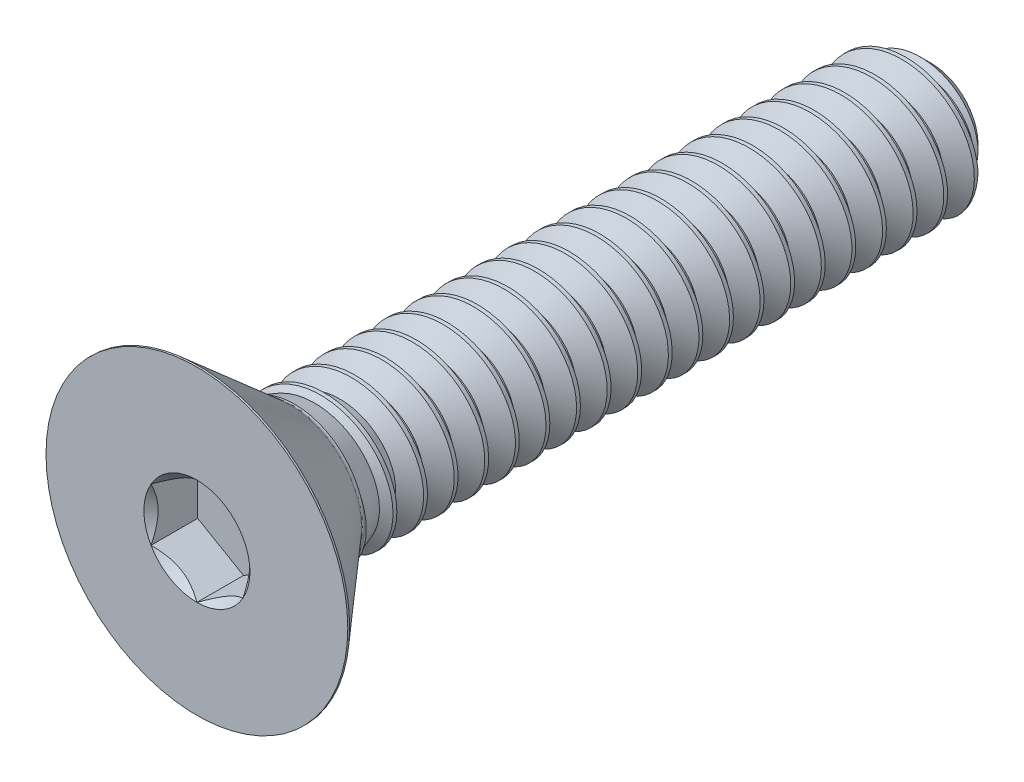
from build123d import *

# Parameters (mm, degrees)
SKETCH10_R         = 1.833087105
CUT_EXTRUDE2_DEPTH = 1.6129
CUT_EXTRUDE2_DRAFT = -45
CUT_EXTRUDE1_DEPTH = 1.6129
CUT_SWEEP1_PITCH   = 1.058333333
CUT_SWEEP1_TO      = 22.017366


with BuildPart() as part:
    # Sketch2 → Revolve1 (revolve)
    with BuildSketch(Plane(origin=(0, 0, 0), x_dir=(0, 0, -1), z_dir=(1, 0, 0)), mode=Mode.PRIVATE) as revolve1_sk:
        with BuildLine():
            Line((-12.635484, 5.2197), (-9.4742, 2.471637744))
            ThreePointArc((-9.4742, 2.471637744), (-9.40108483, 2.428138789), (-9.317366229, 2.413))
            Line((-9.317366229, 2.413), (11.90625, 2.413))
            Line((11.90625, 2.413), (12.7, 1.61925))
            Line((12.7, 1.61925), (12.7, 0))
            Line((12.7, 0), (-12.7, 0))
            Line((-12.7, 0), (-12.7, 5.2197))
            Line((-12.7, 5.2197), (-12.635484, 5.2197))
        make_face()
    revolve(revolve1_sk.sketch.rotate(Axis((0, 0, -12.7), (0, 0, 1)), 90), axis=Axis((0, 0, -12.7), (0, 0, 1)))


with BuildPart() as cut_extrude2_tool:
    # Sketch10 → Cut-Extrude2 (with draft: the straight prism first)
    with BuildSketch(Plane.XY.offset(12.7)):
        Circle(SKETCH10_R)
    extrude(amount=-CUT_EXTRUDE2_DEPTH)
    # Cut-Extrude2: the draft: its side faces are tilted about the plane it starts from
    cut_extrude2_sides = [cut_extrude2_tool.faces().sort_by_distance(p)[0] for p in [
        (-1.833087105, 0, 11.89355),
    ]]
    draft(cut_extrude2_sides, Plane.XY.offset(12.7), CUT_EXTRUDE2_DRAFT)


with BuildPart() as part_1:
    add(part.part)

    # Cut-Extrude2: cut by cut_extrude2_tool
    add(cut_extrude2_tool.part, mode=Mode.SUBTRACT)

    # Sketch9 → Cut-Extrude1 (cut)
    with BuildSketch(Plane.XY.offset(12.7)):
        Polygon((1.5875, -0.916543552), (1.5875, 0.916543552), (0, 1.833087105), (-1.5875, 0.916543552), (-1.5875, -0.916543552), (0, -1.833087105), align=None)
    extrude(amount=-CUT_EXTRUDE1_DEPTH, mode=Mode.SUBTRACT)


with BuildPart() as body_2:
    # Split1: the piece on the far side of the plane
    add(part_1.part)
    split(bisect_by=Plane.XY.offset(9.317366229), keep=Keep.BOTTOM)

    # Cut-Sweep1: arcs per turn and ends read off the stored shape
    # Cut-Sweep1: the profile of Sketch4 screwed along a right-hand helix through 24 turns, 8 arcs to a turn; built about Z, then put on its axis
    cut_sweep1_z = Axis((0, 0, 0), (0, 0, 1))
    cut_sweep1_corners = [(2.470283972, 0, 0.033072917), (2.470283972, 0, -0.959114583), (1.725592336, 0, -0.529166667), (1.725592336, 0, -0.396875)]
    with BuildLine(mode=Mode.PRIVATE) as cut_sweep1_profile:
        Line(cut_sweep1_corners[0], cut_sweep1_corners[1])
        Line(cut_sweep1_corners[1], cut_sweep1_corners[2])
        Line(cut_sweep1_corners[2], cut_sweep1_corners[3])
        Line(cut_sweep1_corners[3], cut_sweep1_corners[0])
    cut_sweep1_cap = Face(cut_sweep1_profile.wire())
    cut_sweep1_turn_angles = [0, 22.5, 45, 67.5, 90, 112.5, 135, 157.5, 180, 202.5, 225, 247.5, 270, 292.5, 315, 337.5, 360]
    cut_sweep1_turn_weights = [1, 0.9238795325112867, 1, 0.9238795325112867, 1, 0.9238795325112867, 1, 0.9238795325112867, 1, 0.9238795325112867, 1, 0.9238795325112867, 1, 0.9238795325112867, 1, 0.9238795325112867, 1]
    cut_sweep1_turn_rails = [Edge.make_bspline([Vector(p[0], p[1], 0).rotate(cut_sweep1_z, cut_sweep1_turn_angles[k]) / cut_sweep1_turn_weights[k] + Vector(0, 0, p[2] + CUT_SWEEP1_PITCH * cut_sweep1_turn_angles[k] / 360) for k in range(17)], [0, 0, 0, 1, 1, 2, 2, 3, 3, 4, 4, 5, 5, 6, 6, 7, 7, 8, 8, 8], 2, cut_sweep1_turn_weights) for p in cut_sweep1_corners]
    cut_sweep1_turn_sides = [Face.make_surface_from_curves(cut_sweep1_turn_rails[p[0]], cut_sweep1_turn_rails[p[1]]) for p in [(0, 1), (1, 2), (2, 3), (3, 0)]]
    cut_sweep1 = Plane(origin=(0, 0, -12.7), x_dir=(0, 1, 0), z_dir=(0, 0, 1)) * split(Solid(Shell([*[p.moved(Location((0, 0, CUT_SWEEP1_PITCH * i))) for i in range(24) for p in cut_sweep1_turn_sides], cut_sweep1_cap, cut_sweep1_cap.rotate(cut_sweep1_z, 8640).moved(Location((0, 0, CUT_SWEEP1_PITCH * 8640 / 360)))])), bisect_by=Plane.XY.offset(CUT_SWEEP1_TO), keep=Keep.BOTTOM, mode=Mode.PRIVATE)
    add(cut_sweep1, mode=Mode.SUBTRACT)


with BuildPart() as part_2:
    add(part_1.part)

    # Split1
    split(bisect_by=Plane.XY.offset(9.317366229), keep=Keep.TOP)

    add(body_2.part)  # Boss-Extrude2 merges body 2
    # Boss-Extrude2 cone 1 section (through the dimple's axis) → Boss-Extrude2 (revolve)
    with BuildSketch(Plane(origin=(0, 0, 9.317366229), x_dir=(0, -1, 0), z_dir=(1, 0, 0))):
        Polygon((0, 0), (2.413, 0), (0, 6.629663013), align=None)
    revolve(axis=Axis((0, 0, 9.317366229), (0, 0, -1)))


solid = part_2.part
